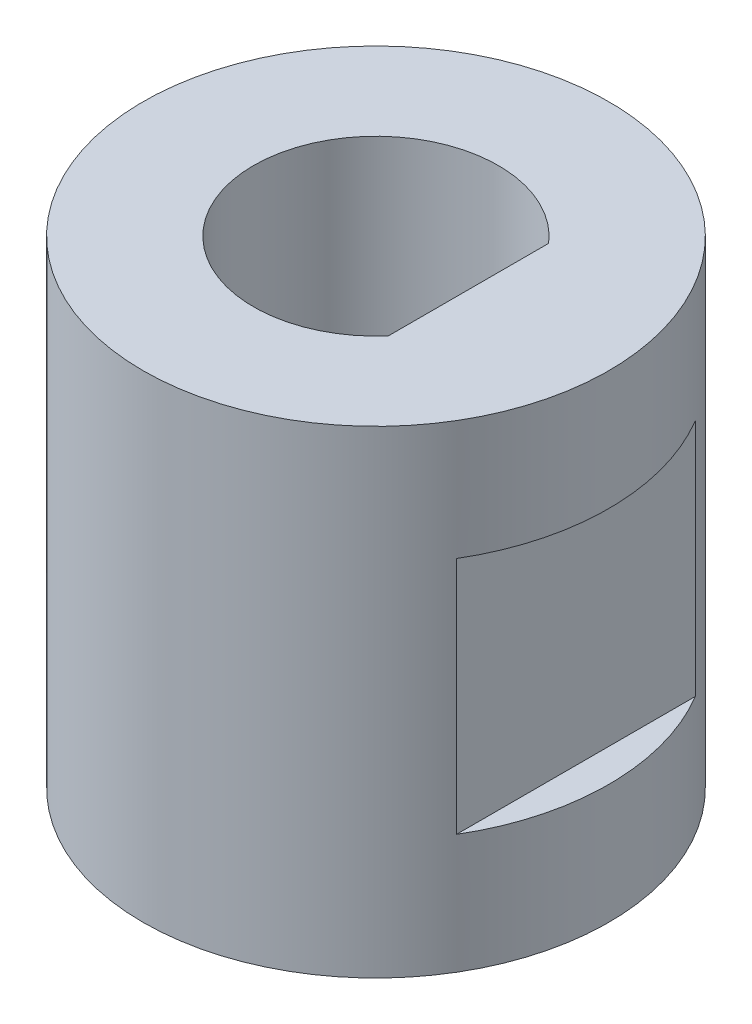
from build123d import *
from build123d.topology import SkipClean

# Parameters (mm, degrees)
SKETCH1_R           = 3.9
BOSS_EXTRUDE1_DEPTH = 2
BOSS_EXTRUDE2_DEPTH = 4
SKETCH4_R           = 3.9
BOSS_EXTRUDE3_DEPTH = 2
CUT_EXTRUDE1_DEPTH  = 10.71699542


with BuildPart() as part:
    # Sketch1 → Boss-Extrude1 (new body)
    with BuildSketch(Plane(origin=(0, 0, 0), x_dir=(1, 0, 0), z_dir=(0, 1, 0))):
        Circle(SKETCH1_R)
    extrude(amount=BOSS_EXTRUDE1_DEPTH)

    # Sketch3 → Boss-Extrude2 (add)
    with SkipClean():  # the faces are left unmerged after this step: merging them gives an invalid solid
        with BuildSketch(Plane(origin=(0, 2, 0), x_dir=(1, 0, 0), z_dir=(0, 1, 0))):
            with BuildLine():
                Line((-2, 3.348133809), (2, 3.348133809))
                ThreePointArc((2, 3.348133809), (2.757716447, 2.757716447), (3.348133809, 2))
                Line((3.348133809, 2), (3.348133809, -2))
                ThreePointArc((3.348133809, -2), (-2.757716447, -2.757716447), (-2, 3.348133809))
            make_face()
        extrude(amount=BOSS_EXTRUDE2_DEPTH)

    # Sketch4 → Boss-Extrude3 (add)
    with SkipClean():  # the faces are left unmerged after this step: merging them gives an invalid solid
        with BuildSketch(Plane(origin=(0, 6, 0), x_dir=(1, 0, 0), z_dir=(0, 1, 0))):
            Circle(SKETCH4_R)
        extrude(amount=BOSS_EXTRUDE3_DEPTH)

    # Sketch5 → Cut-Extrude1 (cut, through all)
    with SkipClean():  # the faces are left unmerged after this step: merging them gives an invalid solid
        with BuildSketch(Plane(origin=(0, 8, 0), x_dir=(1, 0, 0), z_dir=(0, 1, 0))):
            with BuildLine():
                Line((1.55, 1.341640786), (1.55, -1.341640786))
                ThreePointArc((1.55, -1.341640786), (-2.05, 0), (1.55, 1.341640786))
            make_face()
        extrude(amount=-CUT_EXTRUDE1_DEPTH, mode=Mode.SUBTRACT)


solid = part.part
